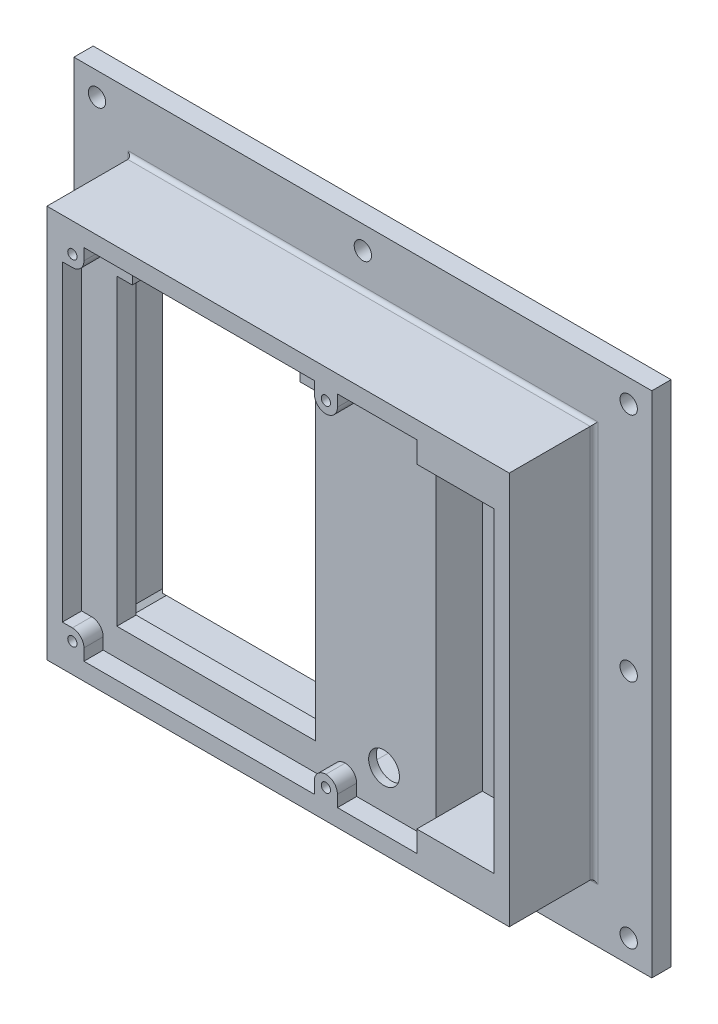
from build123d import *

# Parameters (mm, degrees)
SKETCH_1_W          = 120
SKETCH_1_H          = 102
EXTRUDE_1_DEPTH     = 22
SKETCH_2_W          = 112
SKETCH_2_H          = 94
CUT_EXTRUDE_1_DEPTH = 160.022011055
SKETCH_3_W          = 150
SKETCH_3_H          = 132
SKETCH_3_W_2        = 112
SKETCH_3_H_2        = 94
EXTRUDE_2_DEPTH     = 5
SKETCH_4_W          = 112
SKETCH_4_H          = 15
EXTRUDE_3_DEPTH     = 5
SKETCH_6_R          = 1.2
CUT_EXTRUDE_2_DEPTH = 180.994444359
FILLET_1_R          = 1
SKETCH_7_R          = 2.25
CUT_EXTRUDE_3_DEPTH = 180.994444359
SKETCH_8_W          = 24
SKETCH_8_H          = 94
EXTRUDE_4_DEPTH     = 15
SKETCH_9_W          = 20
SKETCH_9_H          = 82
CUT_EXTRUDE_4_DEPTH = 17
SKETCH_10_R         = 4
CUT_EXTRUDE_5_DEPTH = 180.760952378
SKETCH_11_W         = 13.5
SKETCH_11_H         = 18.5
CUT_EXTRUDE_6_DEPTH = 180.451943428
CUT_EXTRUDE1_DEPTH  = 181.673739099
SKETCH2_W           = 20.6
SKETCH2_H           = 93
CUT_EXTRUDE2_DEPTH  = 5
FILLET1_R           = 3
SKETCH3_W           = 27
SKETCH3_H           = 81
BOSS_EXTRUDE1_DEPTH = 0.4
SKETCH4_W           = 88
SKETCH4_H           = 94
BOSS_EXTRUDE2_DEPTH = 6
SKETCH6_W           = 51.5
SKETCH6_H           = 78.7
CUT_EXTRUDE3_DEPTH  = 180.994444359
SKETCH7_W           = 43.5
SKETCH7_H           = 5.4
CUT_EXTRUDE4_DEPTH  = 3.5
SKETCH8_R           = 4
CUT_EXTRUDE5_DEPTH  = 180.994444359
SKETCH9_R           = 8.75
CUT_EXTRUDE6_DEPTH  = 4
CUT_EXTRUDE8_START  = -5
SKETCH11_R          = 1.2
CUT_EXTRUDE8_DEPTH  = 5
SKETCH13_R          = 13.25
CUT_EXTRUDE9_DEPTH  = 16
BOSS_EXTRUDE3_DEPTH = 9
FILLET2_R           = 20
CHAMFER1_SIZE       = 1
CHAMFER2_SIZE       = 1
CHAMFER4_SIZE       = 1


# Some blends are built 0.0001 mm under size
with BuildPart() as part:
    # Эскиз1 → Бобышка-Вытянуть1 (new body)
    with BuildSketch(Plane.XY):
        with Locations((60, 51)):
            Rectangle(SKETCH_1_W, SKETCH_1_H)
    extrude(amount=EXTRUDE_1_DEPTH)

    # Эскиз2 → Вырез-Вытянуть1 (cut, through all)
    with BuildSketch(Plane.XY.offset(22)):
        with Locations((60, 51)):
            Rectangle(SKETCH_2_W, SKETCH_2_H)
    extrude(amount=-CUT_EXTRUDE_1_DEPTH, mode=Mode.SUBTRACT)

    # Эскиз3 → Бобышка-Вытянуть2 (add)
    with BuildSketch(Plane(origin=(0, 0, 0), x_dir=(-1, 0, 0), z_dir=(0, 0, -1))):
        with Locations((-60, 51)):
            Rectangle(SKETCH_3_W, SKETCH_3_H)
        with Locations((-60, 51)):
            Rectangle(SKETCH_3_W_2, SKETCH_3_H_2, mode=Mode.SUBTRACT)
    extrude(amount=EXTRUDE_2_DEPTH)

    # Эскиз4 → Бобышка-Вытянуть3 (add)
    with BuildSketch(Plane.XY.offset(22)):
        with Locations((60, 90.5)):
            Rectangle(SKETCH_4_W, SKETCH_4_H)
        with Locations((60, 11.5)):
            Rectangle(SKETCH_4_W, SKETCH_4_H)
    extrude(amount=-EXTRUDE_3_DEPTH)

    # Эскиз6 → Вырез-Вытянуть2 (cut, through all)
    with BuildSketch(Plane(origin=(0, 0, 17), x_dir=(-1, 0, 0), z_dir=(0, 0, -1))):
        with Locations((-6.6, 94.5)):
            Circle(SKETCH_6_R)
        with Locations((-72.4, 94.5)):
            Circle(SKETCH_6_R)
        with Locations((-6.6, 7.5)):
            Circle(SKETCH_6_R)
        with Locations((-72.4, 7.5)):
            Circle(SKETCH_6_R)
    extrude(amount=-CUT_EXTRUDE_2_DEPTH, mode=Mode.SUBTRACT)

    # Скругление1
    fillet_1_edges = [part.edges().sort_by_distance(p)[0] for p in [
        (60, 102, 0),
        (120, 51, 0),
        (60, 0, 0),
        (0, 51, 0),
    ]]
    fillet(fillet_1_edges, radius=FILLET_1_R)

    # Эскиз7 → Вырез-Вытянуть3 (cut, through all)
    with BuildSketch(Plane.XY):
        with Locations((-9, 111)):
            Circle(SKETCH_7_R)
        with Locations((129, 111)):
            Circle(SKETCH_7_R)
        with Locations((129, -9)):
            Circle(SKETCH_7_R)
        with Locations((-9, -9)):
            Circle(SKETCH_7_R)
        with Locations((-9, 51)):
            Circle(SKETCH_7_R)
        with Locations((60, 111)):
            Circle(SKETCH_7_R)
        with Locations((129, 51)):
            Circle(SKETCH_7_R)
        with Locations((60, -9)):
            Circle(SKETCH_7_R)
    extrude(amount=-CUT_EXTRUDE_3_DEPTH, mode=Mode.SUBTRACT)

    # Эскиз8 → Бобышка-Вытянуть4 (add)
    with BuildSketch(Plane(origin=(0, 0, 17), x_dir=(-1, 0, 0), z_dir=(0, 0, -1))):
        with Locations((-104, 51)):
            Rectangle(SKETCH_8_W, SKETCH_8_H)
    extrude(amount=EXTRUDE_4_DEPTH)

    # Эскиз9 → Вырез-Вытянуть4 (cut)
    with BuildSketch(Plane.XY.offset(22)):
        with Locations((106, 51)):
            Rectangle(SKETCH_9_W, SKETCH_9_H)
    extrude(amount=-CUT_EXTRUDE_4_DEPTH, mode=Mode.SUBTRACT)

    # Эскиз10 → Вырез-Вытянуть5 (cut, through all)
    with BuildSketch(Plane(origin=(0, 0, 2), x_dir=(-1, 0, 0), z_dir=(0, 0, -1))):
        with Locations((-106, 80)):
            Circle(SKETCH_10_R)
        with Locations((-106, 55)):
            Circle(SKETCH_10_R)
    extrude(amount=-CUT_EXTRUDE_5_DEPTH, mode=Mode.SUBTRACT)

    # Эскиз11 → Вырез-Вытянуть6 (cut, through all)
    with BuildSketch(Plane.XY.offset(5)):
        with Locations((106.25, 29.25)):
            Rectangle(SKETCH_11_W, SKETCH_11_H)
    extrude(amount=-CUT_EXTRUDE_6_DEPTH, mode=Mode.SUBTRACT)

    # Sketch1 → Cut-Extrude1 (cut, through all)
    with BuildSketch(Plane.XY.offset(22)):
        with BuildLine():
            Line((3.6, 10.5), (3.6, 91.5))
            Line((3.6, 91.5), (6.6, 91.5))
            ThreePointArc((6.6, 91.5), (8.721320344, 92.378679656), (9.6, 94.5))
            Line((9.6, 94.5), (9.6, 97.5))
            Line((9.6, 97.5), (69.4, 97.5))
            Line((69.4, 97.5), (69.4, 94.5))
            ThreePointArc((69.4, 94.5), (70.278679656, 92.378679656), (72.4, 91.5))
            Line((72.4, 91.5), (75.4, 91.5))
            Line((75.4, 91.5), (75.4, 10.5))
            Line((75.4, 10.5), (72.4, 10.5))
            ThreePointArc((72.4, 10.5), (70.278679656, 9.621320344), (69.4, 7.5))
            Line((69.4, 7.5), (69.4, 4.5))
            Line((69.4, 4.5), (9.6, 4.5))
            Line((9.6, 4.5), (9.6, 7.5))
            ThreePointArc((9.6, 7.5), (8.721320344, 9.621320344), (6.6, 10.5))
            Line((6.6, 10.5), (3.6, 10.5))
        make_face()
    extrude(amount=-CUT_EXTRUDE1_DEPTH, mode=Mode.SUBTRACT)

    # Sketch2 → Cut-Extrude2 (cut)
    with BuildSketch(Plane.XY.offset(22)):
        with Locations((85.7, 51)):
            Rectangle(SKETCH2_W, SKETCH2_H)
    extrude(amount=-CUT_EXTRUDE2_DEPTH, mode=Mode.SUBTRACT)

    # Fillet1
    fillet1_edges = [part.edges().sort_by_distance(p)[0] for p in [
        (75.4, 91.5, 19.5),
        (75.4, 10.5, 19.5),
    ]]
    fillet(fillet1_edges, radius=FILLET1_R - 0.0001)  # a hair under: the kernel refuses the full size

    # Sketch3 → Boss-Extrude1 (add)
    with BuildSketch(Plane(origin=(3.6, 0, 0), x_dir=(0, 0, -1), z_dir=(1, 0, 0))):
        with Locations((-8.5, 51)):
            Rectangle(SKETCH3_W, SKETCH3_H)
    extrude(amount=BOSS_EXTRUDE1_DEPTH)

    # Sketch4 → Boss-Extrude2 (add)
    with BuildSketch(Plane(origin=(0, 0, 17), x_dir=(-1, 0, 0), z_dir=(0, 0, -1))):
        with Locations((-48, 51)):
            Rectangle(SKETCH4_W, SKETCH4_H)
    extrude(amount=BOSS_EXTRUDE2_DEPTH)

    # Sketch6 → Cut-Extrude3 (cut, through all)
    with BuildSketch(Plane.XY.offset(17)):
        with Locations((38.9, 51)):
            Rectangle(SKETCH6_W, SKETCH6_H)
    extrude(amount=-CUT_EXTRUDE3_DEPTH, mode=Mode.SUBTRACT)

    # Sketch7 → Cut-Extrude4 (cut)
    with BuildSketch(Plane.XY.offset(17)):
        with Locations((38.9, 93.05)):
            Rectangle(SKETCH7_W, SKETCH7_H)
    extrude(amount=-CUT_EXTRUDE4_DEPTH, mode=Mode.SUBTRACT)

    # Sketch8 → Cut-Extrude5 (cut, through all)
    with BuildSketch(Plane.XY.offset(17)):
        with Locations((82.5, 14.5)):
            Circle(SKETCH8_R)
    extrude(amount=-CUT_EXTRUDE5_DEPTH, mode=Mode.SUBTRACT)

    # Sketch9 → Cut-Extrude6 (cut)
    with BuildSketch(Plane(origin=(0, 0, 11), x_dir=(-1, 0, 0), z_dir=(0, 0, -1))):
        with Locations((-82.5, 14.5)):
            Circle(SKETCH9_R)
    extrude(amount=-CUT_EXTRUDE6_DEPTH, mode=Mode.SUBTRACT)

    # Sketch11 → Cut-Extrude8 (cut)
    with BuildSketch(Plane.XY.offset(17).offset(CUT_EXTRUDE8_START)):
        with Locations(Location((6.6, 7.5, 0), (0, 0, 180))):
            Circle(SKETCH11_R)
        with Locations(Location((6.6, 94.5, 0), (0, 0, 180))):
            Circle(SKETCH11_R)
        with Locations(Location((72.4, 7.5, 0), (0, 0, 180))):
            Circle(SKETCH11_R)
        with Locations(Location((72.4, 94.5, 0), (0, 0, 180))):
            Circle(SKETCH11_R)
    extrude(amount=CUT_EXTRUDE8_DEPTH, mode=Mode.SUBTRACT)

    # Sketch13 → Cut-Extrude9 (cut)
    with BuildSketch(Plane(origin=(0, 0, -5), x_dir=(-1, 0, 0), z_dir=(0, 0, -1))):
        with Locations((-82.5, 14.5)):
            Circle(SKETCH13_R)
    extrude(amount=-CUT_EXTRUDE9_DEPTH, mode=Mode.SUBTRACT)

    # Sketch14 → Boss-Extrude3 (add)
    with BuildSketch(Plane(origin=(0, 0, 2), x_dir=(-1, 0, 0), z_dir=(0, 0, -1))):
        with BuildLine():
            Line((-92, 4), (-92, 5.263523399))
            ThreePointArc((-92, 5.263523399), (-91.313479381, 4.606311042), (-90.581614938, 4))
            Line((-90.581614938, 4), (-92, 4))
        make_face()
    extrude(amount=-BOSS_EXTRUDE3_DEPTH)

    # Fillet2
    fillet2_edges = [part.edges().sort_by_distance(p)[0] for p in [
        (74.418385062, 4, 3),
        (92, 23.736476601, 6.5),
    ]]
    fillet(fillet2_edges, radius=FILLET2_R)

    # Chamfer1
    chamfer1_edges = [part.edges().sort_by_distance(p)[0] for p in [
        (48, 98, 11),
        (92, 63.919949478, 11),
        (4, 51, 11),
        (64.65, 51, 11),
        (38.9, 90.35, 11),
        (13.15, 51, 11),
        (38.9, 11.65, 11),
        (91.25, 14.5, 11),
        (95.609207756, 12.573559754, 11),
        (36.629718662, 4, 11),
        (92.572092006, 25.090542055, 11),
        (73.32654359, 3.582100158, 11),
    ]]
    chamfer(chamfer1_edges, length=CHAMFER1_SIZE)

    # Chamfer2
    # the kernel refuses this chamfer: 1 mm, written as the material it adds along each edge
    with BuildSketch(Plane(origin=(92, 98, 12.571682988), x_dir=(-0.999621916911297, 0.027495876610582292, 0), z_dir=(0, 0, -1))) as chamfer2_piece_1:
        Polygon((CHAMFER2_SIZE * 0.999621916911, -CHAMFER2_SIZE * 0.0274958766106), (-CHAMFER2_SIZE * 0.0274958766106, -CHAMFER2_SIZE * 0.999621916911), (0, 0), align=None)
    extrude(amount=10.571682988)
    with BuildSketch(Plane(origin=(116, 100.571682988, 2), x_dir=(-0.9996219169112968, 0, 0.027495876610586605), z_dir=(0, -1, 0))) as chamfer2_piece_2:
        Polygon((CHAMFER2_SIZE * 0.999621916911, CHAMFER2_SIZE * 0.0274958766106), (-CHAMFER2_SIZE * 0.0274958766106, CHAMFER2_SIZE * 0.999621916911), (0, 0), align=None)
    extrude(amount=99.143365976)
    with BuildSketch(Plane(origin=(118.571682988, 4, 2), x_dir=(0, 0.9996219169112968, 0.027495876610586487), z_dir=(-1, 0, 0))) as chamfer2_piece_3_section:
        Polygon((CHAMFER2_SIZE * 0.999621916911, CHAMFER2_SIZE * 0.0274958766106), (-CHAMFER2_SIZE * 0.0274958766106, CHAMFER2_SIZE * 0.999621916911), (0, 0), align=None)
    chamfer2_piece_3 = extrude(amount=30.561751038, mode=Mode.PRIVATE)
    chamfer2_piece_3 = chamfer2_piece_3 - Plane(origin=(82.5, 14.5, 1.670206373), x_dir=(-1, 0, 0), z_dir=(0, 0, -1)) * Cylinder(13.25, 66, mode=Mode.PRIVATE)
    add(chamfer2_piece_3)
    with BuildSketch(Plane(origin=(92, 98, 2), x_dir=(0, -0.9996219169112968, 0.027495876610586605), z_dir=(1, 0, 0))) as chamfer2_piece_4:
        Polygon((CHAMFER2_SIZE * 0.999621916911, CHAMFER2_SIZE * 0.0274958766106), (-CHAMFER2_SIZE * 0.0274958766106, CHAMFER2_SIZE * 0.999621916911), (0, 0), align=None)
    extrude(amount=26.571682988)
    with BuildSketch(Plane(origin=(89.428317012, 98, 2), x_dir=(0, -0.9996219169112968, 0.027495876610586605), z_dir=(1, 0, 0))) as chamfer2_piece_5a_section:
        Polygon((CHAMFER2_SIZE * 0.999621916911, CHAMFER2_SIZE * 0.0274958766106), (-CHAMFER2_SIZE * 0.0274958766106, CHAMFER2_SIZE * 0.999621916911), (0, 0), align=None)
    chamfer2_piece_5a = extrude(amount=26.571682988, mode=Mode.PRIVATE)
    chamfer2_piece_5a = split(chamfer2_piece_5a, bisect_by=Plane(origin=(92, 97.670206373, 1.670206373), z_dir=(-1, 0, 0)), keep=Keep.TOP, mode=Mode.PRIVATE)
    with BuildSketch(Plane(origin=(92, 98, 12.571682988), x_dir=(-0.999621916911297, 0.027495876610582292, 0), z_dir=(0, 0, -1))) as chamfer2_piece_5b_section:
        Polygon((CHAMFER2_SIZE * 0.999621916911, -CHAMFER2_SIZE * 0.0274958766106), (-CHAMFER2_SIZE * 0.0274958766106, -CHAMFER2_SIZE * 0.999621916911), (0, 0), align=None)
    chamfer2_piece_5b = extrude(amount=13.143365976, mode=Mode.PRIVATE)
    chamfer2_piece_5b = split(chamfer2_piece_5b, bisect_by=Plane(origin=(91.670206373, 97.670206373, 2), z_dir=(0, 0, -1)), keep=Keep.TOP, mode=Mode.PRIVATE)
    chamfer2_piece_5 = chamfer2_piece_5a & chamfer2_piece_5b
    add(chamfer2_piece_5)
    # the kernel refuses this chamfer: 1 mm, written as the material it takes off along each edge
    with BuildSketch(Plane(origin=(116, 4, -5), x_dir=(-0.02749587661058217, 0, 0.9996219169112968), z_dir=(0, 1, 0)), Plane(origin=(4, 4, -5), x_dir=(-0.9996219169112968, 0, -0.027495876610586556), z_dir=(0, 1, 0))) as chamfer2_2_piece_1:
        Polygon((CHAMFER2_SIZE * 0.999621916911, CHAMFER2_SIZE * 0.0274958766106), (-CHAMFER2_SIZE * 0.0274958766106, CHAMFER2_SIZE * 0.999621916911), (0, 0), align=None)
    extrude(amount=94, mode=Mode.SUBTRACT)
    with BuildSketch(Plane(origin=(88.00993195, 4, -5), x_dir=(0, 0.027495876610586487, 0.9996219169112968), z_dir=(1, 0, 0))) as chamfer2_2_piece_2:
        Polygon((CHAMFER2_SIZE * 0.999621916911, CHAMFER2_SIZE * 0.0274958766106), (-CHAMFER2_SIZE * 0.0274958766106, CHAMFER2_SIZE * 0.999621916911), (0, 0), align=None)
    extrude(amount=27.99006805, mode=Mode.SUBTRACT)
    with BuildSketch(Plane(origin=(116, 98, -5), x_dir=(0, -0.02749587661058217, 0.9996219169112968), z_dir=(-1, 0, 0))) as chamfer2_2_piece_3:
        Polygon((CHAMFER2_SIZE * 0.999621916911, CHAMFER2_SIZE * 0.0274958766106), (-CHAMFER2_SIZE * 0.0274958766106, CHAMFER2_SIZE * 0.999621916911), (0, 0), align=None)
    extrude(amount=112, mode=Mode.SUBTRACT)
    with BuildSketch(Plane(origin=(82.5, 14.5, -5), x_dir=(0.7513473566279231, -0.6599069250191519, 0), z_dir=(0.6599069250191519, 0.7513473566279231, 0))) as chamfer2_2_piece_4:
        Polygon((13.25, -CHAMFER2_SIZE), (13.25 + CHAMFER2_SIZE, 0), (13.25, 0), align=None)
    revolve(axis=Axis((82.5, 14.5, -5), (0, 0, -1)), revolution_arc=72.173700394, mode=Mode.SUBTRACT)
    with BuildSketch(Plane(origin=(4, 4, -5), x_dir=(0, 0.027495876610586053, 0.9996219169112968), z_dir=(1, 0, 0))) as chamfer2_2_piece_5:
        Polygon((CHAMFER2_SIZE * 0.999621916911, CHAMFER2_SIZE * 0.0274958766106), (-CHAMFER2_SIZE * 0.0274958766106, CHAMFER2_SIZE * 0.999621916911), (0, 0), align=None)
    extrude(amount=65.259437323, mode=Mode.SUBTRACT)
    with BuildSketch(Plane(origin=(69.259437323, -16, -5), x_dir=(0, 1, 0), z_dir=(-1, 0, 0))) as chamfer2_2_piece_6:
        Polygon((20, -CHAMFER2_SIZE), (20 - CHAMFER2_SIZE, 0), (20, 0), align=None)
    revolve(axis=Axis((69.259437323, -16, -5), (0, 0, -1)), revolution_arc=23.466475145, mode=Mode.SUBTRACT)
    with BuildSketch(Plane(origin=(116, 1.428317012, -5), x_dir=(-0.02749587661058217, 0, 0.9996219169112968), z_dir=(0, 1, 0))) as chamfer2_2_piece_7a_section:
        Polygon((CHAMFER2_SIZE * 0.999621916911, CHAMFER2_SIZE * 0.0274958766106), (-CHAMFER2_SIZE * 0.0274958766106, CHAMFER2_SIZE * 0.999621916911), (0, 0), align=None)
    chamfer2_2_piece_7a = extrude(amount=96.571682988, mode=Mode.PRIVATE)
    chamfer2_2_piece_7a = split(chamfer2_2_piece_7a, bisect_by=Plane(origin=(116.329793627, 4, -4.670206373), z_dir=(0, -1, 0)), keep=Keep.TOP, mode=Mode.PRIVATE)
    with BuildSketch(Plane(origin=(88.00993195, 4, -5), x_dir=(0, 0.027495876610586487, 0.9996219169112968), z_dir=(1, 0, 0))) as chamfer2_2_piece_7b_section:
        Polygon((CHAMFER2_SIZE * 0.999621916911, CHAMFER2_SIZE * 0.0274958766106), (-CHAMFER2_SIZE * 0.0274958766106, CHAMFER2_SIZE * 0.999621916911), (0, 0), align=None)
    chamfer2_2_piece_7b = extrude(amount=30.561751038, mode=Mode.PRIVATE)
    chamfer2_2_piece_7b = split(chamfer2_2_piece_7b, bisect_by=Plane(origin=(116, 3.670206373, -4.670206373), z_dir=(1, 0, 0)), keep=Keep.TOP, mode=Mode.PRIVATE)
    chamfer2_2_piece_7 = chamfer2_2_piece_7a & chamfer2_2_piece_7b
    add(chamfer2_2_piece_7, mode=Mode.SUBTRACT)
    with BuildSketch(Plane(origin=(118.571682988, 98, -5), x_dir=(0, -0.02749587661058217, 0.9996219169112968), z_dir=(-1, 0, 0))) as chamfer2_2_piece_8a_section:
        Polygon((CHAMFER2_SIZE * 0.999621916911, CHAMFER2_SIZE * 0.0274958766106), (-CHAMFER2_SIZE * 0.0274958766106, CHAMFER2_SIZE * 0.999621916911), (0, 0), align=None)
    chamfer2_2_piece_8a = extrude(amount=114.571682988, mode=Mode.PRIVATE)
    chamfer2_2_piece_8a = split(chamfer2_2_piece_8a, bisect_by=Plane(origin=(116, 98.329793627, -4.670206373), z_dir=(1, 0, 0)), keep=Keep.TOP, mode=Mode.PRIVATE)
    with BuildSketch(Plane(origin=(116, 4, -5), x_dir=(-0.02749587661058217, 0, 0.9996219169112968), z_dir=(0, 1, 0))) as chamfer2_2_piece_8b_section:
        Polygon((CHAMFER2_SIZE * 0.999621916911, CHAMFER2_SIZE * 0.0274958766106), (-CHAMFER2_SIZE * 0.0274958766106, CHAMFER2_SIZE * 0.999621916911), (0, 0), align=None)
    chamfer2_2_piece_8b = extrude(amount=96.571682988, mode=Mode.PRIVATE)
    chamfer2_2_piece_8b = split(chamfer2_2_piece_8b, bisect_by=Plane(origin=(116.329793627, 98, -4.670206373), z_dir=(0, 1, 0)), keep=Keep.TOP, mode=Mode.PRIVATE)
    chamfer2_2_piece_8 = chamfer2_2_piece_8a & chamfer2_2_piece_8b
    add(chamfer2_2_piece_8, mode=Mode.SUBTRACT)
    with BuildSketch(Plane(origin=(1.428317012, 4, -5), x_dir=(0, 0.027495876610586487, 0.9996219169112968), z_dir=(1, 0, 0))) as chamfer2_2_piece_9a_section:
        Polygon((CHAMFER2_SIZE * 0.999621916911, CHAMFER2_SIZE * 0.0274958766106), (-CHAMFER2_SIZE * 0.0274958766106, CHAMFER2_SIZE * 0.999621916911), (0, 0), align=None)
    chamfer2_2_piece_9a = extrude(amount=67.831120311, mode=Mode.PRIVATE)
    chamfer2_2_piece_9a = split(chamfer2_2_piece_9a, bisect_by=Plane(origin=(4, 3.670206373, -4.670206373), z_dir=(-1, 0, 0)), keep=Keep.TOP, mode=Mode.PRIVATE)
    with BuildSketch(Plane(origin=(4, 1.428317012, -5), x_dir=(-0.9996219169112968, 0, -0.027495876610586487), z_dir=(0, 1, 0))) as chamfer2_2_piece_9b_section:
        Polygon((CHAMFER2_SIZE * 0.999621916911, CHAMFER2_SIZE * 0.0274958766106), (-CHAMFER2_SIZE * 0.0274958766106, CHAMFER2_SIZE * 0.999621916911), (0, 0), align=None)
    chamfer2_2_piece_9b = extrude(amount=96.571682988, mode=Mode.PRIVATE)
    chamfer2_2_piece_9b = split(chamfer2_2_piece_9b, bisect_by=Plane(origin=(3.670206373, 4, -4.670206373), z_dir=(0, -1, 0)), keep=Keep.TOP, mode=Mode.PRIVATE)
    chamfer2_2_piece_9 = chamfer2_2_piece_9a & chamfer2_2_piece_9b
    add(chamfer2_2_piece_9, mode=Mode.SUBTRACT)
    with BuildSketch(Plane(origin=(116, 98, -5), x_dir=(0, -0.02749587661058217, 0.9996219169112968), z_dir=(-1, 0, 0))) as chamfer2_2_piece_10a_section:
        Polygon((CHAMFER2_SIZE * 0.999621916911, CHAMFER2_SIZE * 0.0274958766106), (-CHAMFER2_SIZE * 0.0274958766106, CHAMFER2_SIZE * 0.999621916911), (0, 0), align=None)
    chamfer2_2_piece_10a = extrude(amount=114.571682988, mode=Mode.PRIVATE)
    chamfer2_2_piece_10a = split(chamfer2_2_piece_10a, bisect_by=Plane(origin=(4, 98.329793627, -4.670206373), z_dir=(-1, 0, 0)), keep=Keep.TOP, mode=Mode.PRIVATE)
    with BuildSketch(Plane(origin=(4, 4, -5), x_dir=(-0.9996219169112968, 0, -0.027495876610586556), z_dir=(0, 1, 0))) as chamfer2_2_piece_10b_section:
        Polygon((CHAMFER2_SIZE * 0.999621916911, CHAMFER2_SIZE * 0.0274958766106), (-CHAMFER2_SIZE * 0.0274958766106, CHAMFER2_SIZE * 0.999621916911), (0, 0), align=None)
    chamfer2_2_piece_10b = extrude(amount=96.571682988, mode=Mode.PRIVATE)
    chamfer2_2_piece_10b = split(chamfer2_2_piece_10b, bisect_by=Plane(origin=(3.670206373, 98, -4.670206373), z_dir=(0, 1, 0)), keep=Keep.TOP, mode=Mode.PRIVATE)
    chamfer2_2_piece_10 = chamfer2_2_piece_10a & chamfer2_2_piece_10b
    add(chamfer2_2_piece_10, mode=Mode.SUBTRACT)

    # Chamfer4
    chamfer4_edges = [part.edges().sort_by_distance(p)[0] for p in [
        (4, 4, 3),
        (4, 98, 3),
        (116, 4, -1.5),
        (116, 98, -1.5),
    ]]
    chamfer(chamfer4_edges, length=CHAMFER4_SIZE)


solid = part.part
